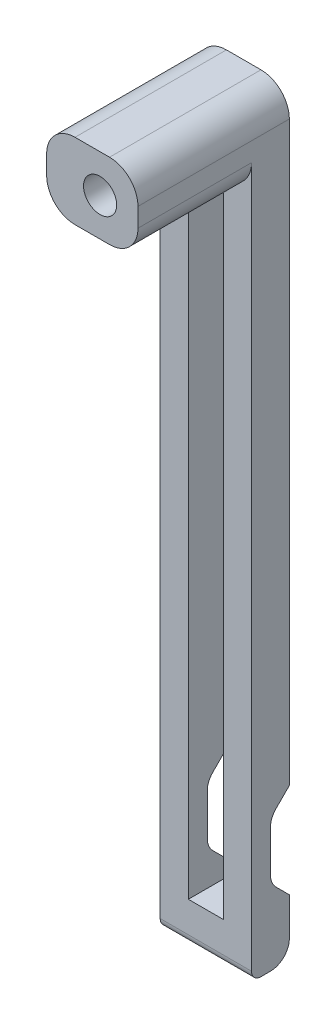
from build123d import *

# Parameters (mm, degrees)
BODY_2_W                        = 9.65
BODY_2_H                        = 80
BODY_DEPTH                      = 2
SKIZZE2_W                       = 3.7
SKIZZE2_H                       = 66.5
RUT_DEPTH                       = 41.488030639
NOTCH_DEPTH                     = 42.196146664
VERRUNDUNG3_R                   = 2
VERRUNDUNG4_R                   = 1
VERRUNDUNG5_R                   = 1
SKIZZE4_W                       = 9.65
SKIZZE4_H                       = 8
AUFSATZ_LINEAR_AUSTRAGEN1_DEPTH = 12
VERRUNDUNG6_R                   = 2
SKIZZE5_R                       = 1.75
LOCH_DEPTH                      = 44.35067041
VERRUNDUNG7_R                   = 3


with BuildPart() as part:
    # body 2 → body (new, symmetric)
    with BuildSketch(Plane.XY):
        Rectangle(BODY_2_W, BODY_2_H)
    extrude(amount=BODY_DEPTH, both=True)

    # Skizze2 → rut (cut, through all)
    with BuildSketch(Plane.XY.offset(2)):
        with Locations((0, -2.5)):
            Rectangle(SKIZZE2_W, SKIZZE2_H)
    extrude(amount=-RUT_DEPTH, mode=Mode.SUBTRACT)

    # spare → notch (cut, through all)
    with BuildSketch(Plane(origin=(4.825, 0, 0), x_dir=(0, 0, -1), z_dir=(1, 0, 0))):
        Polygon((2, -24), (0, -26), (0, -32), (2, -34), align=None)
    extrude(amount=-NOTCH_DEPTH, mode=Mode.SUBTRACT)

    # Verrundung3
    verrundung3_edges = [part.edges().sort_by_distance(p)[0] for p in [
        (-3.3375, -32, 0),
        (-3.3375, -26, 0),
        (3.3375, -26, 0),
        (3.3375, -32, 0),
    ]]
    fillet(verrundung3_edges, radius=VERRUNDUNG3_R)

    # Verrundung4
    verrundung4_edges = [part.edges().sort_by_distance(p)[0] for p in [
        (0, -40, 2),
    ]]
    fillet(verrundung4_edges, radius=VERRUNDUNG4_R)

    # Verrundung5
    verrundung5_edges = [part.edges().sort_by_distance(p)[0] for p in [
        (-3.3375, -34, -2),
        (-3.3375, -24, -2),
    ]]
    fillet(verrundung5_edges, radius=VERRUNDUNG5_R)

    # Skizze4 → Aufsatz-Linear austragen1 (add)
    with BuildSketch(Plane.XY.offset(2)):
        with Locations((0, 36)):
            Rectangle(SKIZZE4_W, SKIZZE4_H)
    extrude(amount=AUFSATZ_LINEAR_AUSTRAGEN1_DEPTH)

    # Verrundung6
    verrundung6_edges = [part.edges().sort_by_distance(p)[0] for p in [
        (0, -40, -2),
    ]]
    fillet(verrundung6_edges, radius=VERRUNDUNG6_R)

    # Skizze5 → loch (cut, through all)
    with BuildSketch(Plane.XY.offset(14)):
        with Locations((0.825, 36)):
            Circle(SKIZZE5_R)
    extrude(amount=-LOCH_DEPTH, mode=Mode.SUBTRACT)

    # Verrundung7
    verrundung7_edges = [part.edges().sort_by_distance(p)[0] for p in [
        (-4.825, 40, 6),
        (4.825, 40, 6),
        (-4.825, 32, 8),
        (4.825, 32, 8),
    ]]
    fillet(verrundung7_edges, radius=VERRUNDUNG7_R)


solid = part.part
